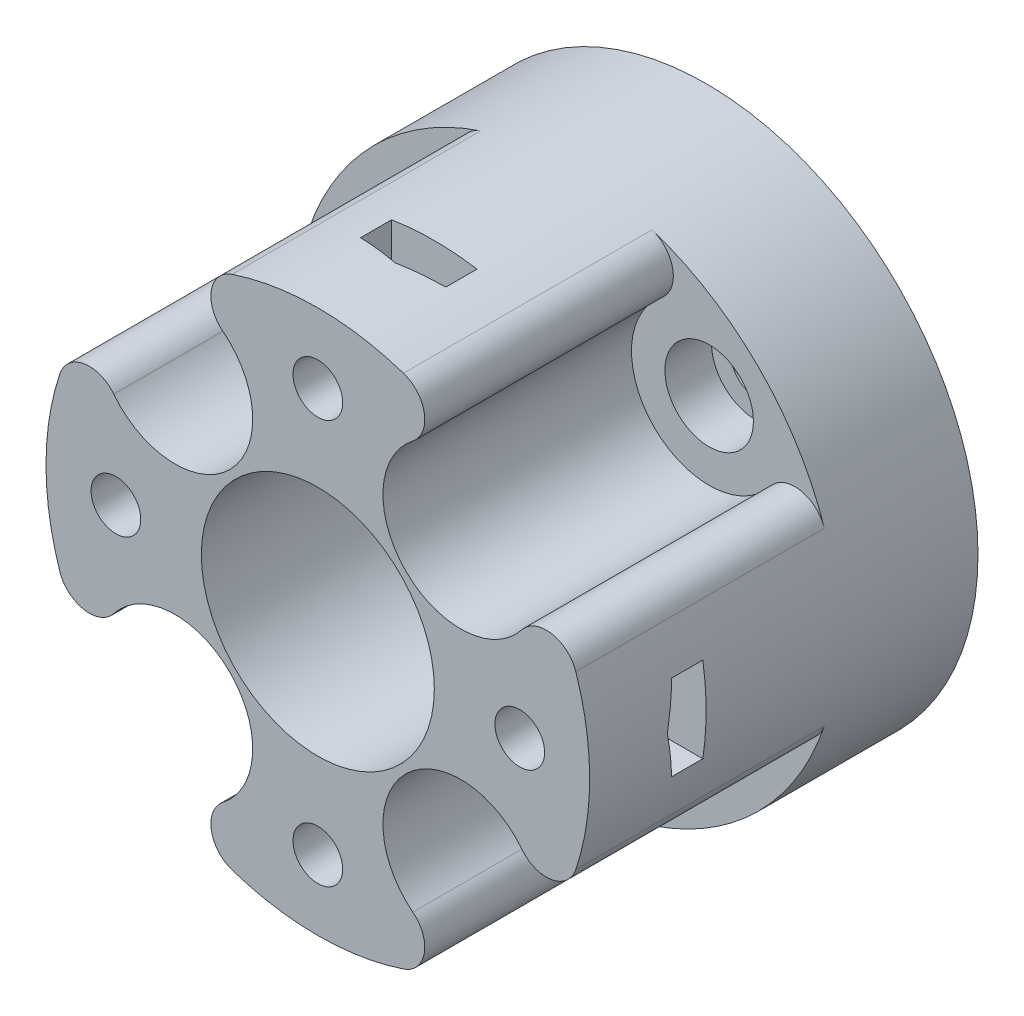
from build123d import *

# Parameters (mm, degrees)
SKETCH1_R           = 17.5
SKETCH1_R_2         = 2.85
BOSS_EXTRUDE1_DEPTH = 25
SKETCH1_3_R         = 2.85
SKETCH1_3_R_2       = 1.6
BOSS_EXTRUDE2_DEPTH = 6
SKETCH2_R           = 5
CUT_EXTRUDE1_DEPTH  = 16
FILLET1_R           = 2
CUT_EXTRUDE2_START  = -7.5
SKETCH3_R           = 1.6
CUT_EXTRUDE2_DEPTH  = 2.5
CUT_EXTRUDE3_START  = -10
SKETCH3_2_R         = 1.6
CUT_EXTRUDE3_DEPTH  = 10
CHAMFER1_SIZE       = 2.75
CHAMFER1_SIZE_2     = 0.5
SKETCH4_R           = 7.5
CUT_EXTRUDE4_DEPTH  = 36.178118369


with BuildPart() as part:
    # Sketch1 → Boss-Extrude1 (new body)
    with BuildSketch(Plane(origin=(0, 0, 0), x_dir=(0, 1, 0), z_dir=(0, 0, 1))):
        with Locations(Location((0, 0, 0), (0, 0, 270))):
            Circle(SKETCH1_R)
        with Locations(Location((-9.192388155, 9.192388155, 0), (0, 0, 270))):
            Circle(SKETCH1_R_2, mode=Mode.SUBTRACT)
        with Locations(Location((-9.192388155, -9.192388155, 0), (0, 0, 270))):
            Circle(SKETCH1_R_2, mode=Mode.SUBTRACT)
        with Locations(Location((9.192388155, -9.192388155, 0), (0, 0, 270))):
            Circle(SKETCH1_R_2, mode=Mode.SUBTRACT)
        with Locations(Location((9.192388155, 9.192388155, 0), (0, 0, 270))):
            Circle(SKETCH1_R_2, mode=Mode.SUBTRACT)
    extrude(amount=BOSS_EXTRUDE1_DEPTH)

    # Sketch1<3> → Boss-Extrude2 (add)
    # profile 1 of 4: a face of its own
    with BuildSketch(Plane(origin=(0, 0, 0), x_dir=(0, 1, 0), z_dir=(0, 0, 1))):
        with Locations(Location((-9.192388155, -9.192388155, 0), (0, 0, 270))):
            Circle(SKETCH1_3_R)
        with Locations(Location((-9.192388155, -9.192388155, 0), (0, 0, 270))):
            Circle(SKETCH1_3_R_2, mode=Mode.SUBTRACT)
    # profile 2 of 4: a face of its own
    with BuildSketch(Plane(origin=(0, 0, 0), x_dir=(0, 1, 0), z_dir=(0, 0, 1))):
        with Locations(Location((-9.192388155, 9.192388155, 0), (0, 0, 270))):
            Circle(SKETCH1_3_R)
        with Locations(Location((-9.192388155, 9.192388155, 0), (0, 0, 270))):
            Circle(SKETCH1_3_R_2, mode=Mode.SUBTRACT)
    # profile 3 of 4: a face of its own
    with BuildSketch(Plane(origin=(0, 0, 0), x_dir=(0, 1, 0), z_dir=(0, 0, 1))):
        with Locations(Location((9.192388155, -9.192388155, 0), (0, 0, 270))):
            Circle(SKETCH1_3_R)
        with Locations(Location((9.192388155, -9.192388155, 0), (0, 0, 270))):
            Circle(SKETCH1_3_R_2, mode=Mode.SUBTRACT)
    # profile 4 of 4: a face of its own
    with BuildSketch(Plane(origin=(0, 0, 0), x_dir=(0, 1, 0), z_dir=(0, 0, 1))):
        with Locations(Location((9.192388155, 9.192388155, 0), (0, 0, 270))):
            Circle(SKETCH1_3_R)
        with Locations(Location((9.192388155, 9.192388155, 0), (0, 0, 270))):
            Circle(SKETCH1_3_R_2, mode=Mode.SUBTRACT)
    extrude(amount=BOSS_EXTRUDE2_DEPTH)

    # Sketch2 → Cut-Extrude1 (cut)
    with BuildSketch(Plane.XY.offset(25)):
        with Locations((-9.192388155, 9.192388155)):
            Circle(SKETCH2_R)
        with Locations((9.192388155, 9.192388155)):
            Circle(SKETCH2_R)
        with Locations((9.192388155, -9.192388155)):
            Circle(SKETCH2_R)
        with Locations((-9.192388155, -9.192388155)):
            Circle(SKETCH2_R)
    extrude(amount=-CUT_EXTRUDE1_DEPTH, mode=Mode.SUBTRACT)

    # Fillet1
    fillet1_edges = [part.edges().sort_by_distance(p)[0] for p in [
        (-14.028560913, -10.46181049, 17),
        (-10.46181049, -14.028560913, 17),
        (10.46181049, -14.028560913, 17),
        (14.028560913, -10.46181049, 17),
        (14.028560913, 10.46181049, 17),
        (10.46181049, 14.028560913, 17),
        (-10.46181049, 14.028560913, 17),
        (-14.028560913, 10.46181049, 17),
    ]]
    fillet(fillet1_edges, radius=FILLET1_R)

    # Sketch3 → Cut-Extrude2 (cut)
    # profile 1 of 4: a face of its own
    with BuildSketch(Plane.XY.offset(25).offset(CUT_EXTRUDE2_START)):
        with BuildLine():
            Line((-2.75, 15.75), (-2.75, 17.282577933))
            ThreePointArc((-2.75, 17.282577933), (0, 17.5), (2.75, 17.282577933))
            Line((2.75, 17.282577933), (2.75, 15.75))
            Line((2.75, 15.75), (2.75, 10.25))
            Line((2.75, 10.25), (-2.75, 10.25))
            Line((-2.75, 10.25), (-2.75, 15.75))
        make_face()
        with Locations((0, 13)):
            Circle(SKETCH3_R, mode=Mode.SUBTRACT)
    # profile 2 of 4: a face of its own
    with BuildSketch(Plane.XY.offset(25).offset(CUT_EXTRUDE2_START)):
        with BuildLine():
            Line((15.75, -2.75), (10.25, -2.75))
            Line((10.25, -2.75), (10.25, 2.75))
            Line((10.25, 2.75), (15.75, 2.75))
            Line((15.75, 2.75), (17.282577933, 2.75))
            ThreePointArc((17.282577933, 2.75), (17.5, 0), (17.282577933, -2.75))
            Line((17.282577933, -2.75), (15.75, -2.75))
        make_face()
        with Locations((13, 0)):
            Circle(SKETCH3_R, mode=Mode.SUBTRACT)
    # profile 3 of 4: a face of its own
    with BuildSketch(Plane.XY.offset(25).offset(CUT_EXTRUDE2_START)):
        with BuildLine():
            Line((-2.75, -15.75), (-2.75, -10.25))
            Line((-2.75, -10.25), (2.75, -10.25))
            Line((2.75, -10.25), (2.75, -15.75))
            Line((2.75, -15.75), (2.75, -17.282577933))
            ThreePointArc((2.75, -17.282577933), (0, -17.5), (-2.75, -17.282577933))
            Line((-2.75, -17.282577933), (-2.75, -15.75))
        make_face()
        with Locations((0, -13)):
            Circle(SKETCH3_R, mode=Mode.SUBTRACT)
    # profile 4 of 4: a face of its own
    with BuildSketch(Plane.XY.offset(25).offset(CUT_EXTRUDE2_START)):
        with BuildLine():
            Line((-15.75, 2.75), (-10.25, 2.75))
            Line((-10.25, 2.75), (-10.25, -2.75))
            Line((-10.25, -2.75), (-15.75, -2.75))
            Line((-15.75, -2.75), (-17.282577933, -2.75))
            ThreePointArc((-17.282577933, -2.75), (-17.5, 0), (-17.282577933, 2.75))
            Line((-17.282577933, 2.75), (-15.75, 2.75))
        make_face()
        with Locations((-13, 0)):
            Circle(SKETCH3_R, mode=Mode.SUBTRACT)
    extrude(amount=CUT_EXTRUDE2_DEPTH, mode=Mode.SUBTRACT)

    # Sketch3<2> → Cut-Extrude3 (cut)
    with BuildSketch(Plane.XY.offset(25).offset(CUT_EXTRUDE3_START)):
        with Locations((-13, 0)):
            Circle(SKETCH3_2_R)
        with Locations((0, 13)):
            Circle(SKETCH3_2_R)
        with Locations((13, 0)):
            Circle(SKETCH3_2_R)
        with Locations((0, -13)):
            Circle(SKETCH3_2_R)
    extrude(amount=CUT_EXTRUDE3_DEPTH, mode=Mode.SUBTRACT)

    # Chamfer1
    # the kernel refuses this chamfer: 2.75, 0.5 mm, written as the material it adds along each edge
    with BuildSketch(Plane(origin=(-3.104266441, -2.75, 20), x_dir=(1.0355932807417332e-14, 0.9999763028084744, 0.006884317068104265), z_dir=(-1, 0, 0))) as chamfer1_piece_1_section:
        Polygon((CHAMFER1_SIZE * 0.999976302808, CHAMFER1_SIZE * 0.0068843170681), (-CHAMFER1_SIZE_2 * 0.0068843170681, CHAMFER1_SIZE_2 * 0.999976302808), (0, 0), align=None)
    chamfer1_piece_1 = extrude(amount=21.324045051, mode=Mode.PRIVATE)
    chamfer1_piece_1 = chamfer1_piece_1 & Plane(origin=(0, 0, 19.863927103), x_dir=(1, 0, 0), z_dir=(0, 0, -1)) * Cylinder(17.5, 54, mode=Mode.PRIVATE)
    chamfer1_piece_1 = chamfer1_piece_1 - Plane(origin=(-13, 0, 19.863927103), x_dir=(1, 0, 0), z_dir=(0, 0, -1)) * Cylinder(1.6, 54, mode=Mode.PRIVATE)
    add(chamfer1_piece_1)
    with BuildSketch(Plane(origin=(-24.428311492, 2.75, 20), x_dir=(2.1371797081769355e-15, 0.20388124945923355, -0.9789956262001082), z_dir=(1, 0, 0))) as chamfer1_piece_2_section:
        Polygon((CHAMFER1_SIZE_2 * 0.9789956262, -CHAMFER1_SIZE_2 * 0.203881249459), (-CHAMFER1_SIZE * 0.203881249459, -CHAMFER1_SIZE * 0.9789956262), (0, 0), align=None)
    chamfer1_piece_2 = extrude(amount=21.324045051, mode=Mode.PRIVATE)
    chamfer1_piece_2 = chamfer1_piece_2 & Plane(origin=(0, 0, 19.852070676), x_dir=(1, 0, 0), z_dir=(0, 0, -1)) * Cylinder(17.5, 54, mode=Mode.PRIVATE)
    chamfer1_piece_2 = chamfer1_piece_2 - Plane(origin=(-13, 0, 19.852070676), x_dir=(1, 0, 0), z_dir=(0, 0, -1)) * Cylinder(1.6, 54, mode=Mode.PRIVATE)
    add(chamfer1_piece_2)
    with BuildSketch(Plane(origin=(-2.75, 3.104266441, 20), x_dir=(0.9999763028084744, 0, 0.006884317068104265), z_dir=(0, 1, 0))) as chamfer1_piece_3_section:
        Polygon((CHAMFER1_SIZE * 0.999976302808, CHAMFER1_SIZE * 0.0068843170681), (-CHAMFER1_SIZE_2 * 0.0068843170681, CHAMFER1_SIZE_2 * 0.999976302808), (0, 0), align=None)
    chamfer1_piece_3 = extrude(amount=21.324045051, mode=Mode.PRIVATE)
    chamfer1_piece_3 = chamfer1_piece_3 & Plane(origin=(0, 0, 19.863927103), x_dir=(1, 0, 0), z_dir=(0, 0, -1)) * Cylinder(17.5, 54, mode=Mode.PRIVATE)
    chamfer1_piece_3 = chamfer1_piece_3 - Plane(origin=(0, 13, 19.863927103), x_dir=(1, 0, 0), z_dir=(0, 0, -1)) * Cylinder(1.6, 54, mode=Mode.PRIVATE)
    add(chamfer1_piece_3)
    with BuildSketch(Plane(origin=(2.75, 24.428311492, 20), x_dir=(0.20388124945923355, 0, -0.9789956262001082), z_dir=(0, -1, 0))) as chamfer1_piece_4_section:
        Polygon((CHAMFER1_SIZE_2 * 0.9789956262, -CHAMFER1_SIZE_2 * 0.203881249459), (-CHAMFER1_SIZE * 0.203881249459, -CHAMFER1_SIZE * 0.9789956262), (0, 0), align=None)
    chamfer1_piece_4 = extrude(amount=21.324045051, mode=Mode.PRIVATE)
    chamfer1_piece_4 = chamfer1_piece_4 & Plane(origin=(0, 0, 19.852070749), x_dir=(1, 0, 0), z_dir=(0, 0, -1)) * Cylinder(17.5, 54, mode=Mode.PRIVATE)
    chamfer1_piece_4 = chamfer1_piece_4 - Plane(origin=(0, 13, 19.852070749), x_dir=(1, 0, 0), z_dir=(0, 0, -1)) * Cylinder(1.6, 54, mode=Mode.PRIVATE)
    add(chamfer1_piece_4)
    with BuildSketch(Plane(origin=(3.104266441, 2.75, 20), x_dir=(-3.409880314637416e-15, -0.9999763028084744, 0.006884317068104265), z_dir=(1, 0, 0))) as chamfer1_piece_5_section:
        Polygon((CHAMFER1_SIZE * 0.999976302808, CHAMFER1_SIZE * 0.0068843170681), (-CHAMFER1_SIZE_2 * 0.0068843170681, CHAMFER1_SIZE_2 * 0.999976302808), (0, 0), align=None)
    chamfer1_piece_5 = extrude(amount=21.324045051, mode=Mode.PRIVATE)
    chamfer1_piece_5 = chamfer1_piece_5 & Plane(origin=(0, 0, 19.863927103), x_dir=(1, 0, 0), z_dir=(0, 0, -1)) * Cylinder(17.5, 54, mode=Mode.PRIVATE)
    chamfer1_piece_5 = chamfer1_piece_5 - Plane(origin=(13, 0, 19.863927103), x_dir=(1, 0, 0), z_dir=(0, 0, -1)) * Cylinder(1.6, 54, mode=Mode.PRIVATE)
    add(chamfer1_piece_5)
    with BuildSketch(Plane(origin=(24.428311492, -2.75, 20), x_dir=(3.409880314637416e-15, 0.9999763028084744, 0.006884317068104265), z_dir=(-1, 0, 0))) as chamfer1_piece_6_section:
        Polygon((CHAMFER1_SIZE * 0.999976302808, CHAMFER1_SIZE * 0.0068843170681), (-CHAMFER1_SIZE_2 * 0.0068843170681, CHAMFER1_SIZE_2 * 0.999976302808), (0, 0), align=None)
    chamfer1_piece_6 = extrude(amount=21.324045051, mode=Mode.PRIVATE)
    chamfer1_piece_6 = chamfer1_piece_6 & Plane(origin=(0, 0, 19.852070366), x_dir=(1, 0, 0), z_dir=(0, 0, -1)) * Cylinder(17.5, 54, mode=Mode.PRIVATE)
    chamfer1_piece_6 = chamfer1_piece_6 - Plane(origin=(13, 0, 19.852070366), x_dir=(1, 0, 0), z_dir=(0, 0, -1)) * Cylinder(1.6, 54, mode=Mode.PRIVATE)
    add(chamfer1_piece_6)
    with BuildSketch(Plane(origin=(2.75, -3.104266441, 20), x_dir=(-0.9999763028084744, 6.88290656102737e-15, 0.006884317068104265), z_dir=(0, -1, 0))) as chamfer1_piece_7_section:
        Polygon((CHAMFER1_SIZE * 0.999976302808, CHAMFER1_SIZE * 0.0068843170681), (-CHAMFER1_SIZE_2 * 0.0068843170681, CHAMFER1_SIZE_2 * 0.999976302808), (0, 0), align=None)
    chamfer1_piece_7 = extrude(amount=21.324045051, mode=Mode.PRIVATE)
    chamfer1_piece_7 = chamfer1_piece_7 & Plane(origin=(0, 0, 19.863927103), x_dir=(1, 0, 0), z_dir=(0, 0, -1)) * Cylinder(17.5, 54, mode=Mode.PRIVATE)
    chamfer1_piece_7 = chamfer1_piece_7 - Plane(origin=(0, -13, 19.863927103), x_dir=(1, 0, 0), z_dir=(0, 0, -1)) * Cylinder(1.6, 54, mode=Mode.PRIVATE)
    add(chamfer1_piece_7)
    with BuildSketch(Plane(origin=(-2.75, -24.428311492, 20), x_dir=(-0.20388124945923355, 1.4290779976363847e-15, -0.9789956262001082), z_dir=(0, 1, 0))) as chamfer1_piece_8_section:
        Polygon((CHAMFER1_SIZE_2 * 0.9789956262, -CHAMFER1_SIZE_2 * 0.203881249459), (-CHAMFER1_SIZE * 0.203881249459, -CHAMFER1_SIZE * 0.9789956262), (0, 0), align=None)
    chamfer1_piece_8 = extrude(amount=21.324045051, mode=Mode.PRIVATE)
    chamfer1_piece_8 = chamfer1_piece_8 & Plane(origin=(0, 0, 19.852070422), x_dir=(1, 0, 0), z_dir=(0, 0, -1)) * Cylinder(17.5, 54, mode=Mode.PRIVATE)
    chamfer1_piece_8 = chamfer1_piece_8 - Plane(origin=(0, -13, 19.852070422), x_dir=(1, 0, 0), z_dir=(0, 0, -1)) * Cylinder(1.6, 54, mode=Mode.PRIVATE)
    add(chamfer1_piece_8)

    # Sketch4 → Cut-Extrude4 (cut, through all)
    with BuildSketch(Plane.XY.offset(25)):
        Circle(SKETCH4_R)
    extrude(amount=-CUT_EXTRUDE4_DEPTH, mode=Mode.SUBTRACT)


solid = part.part
